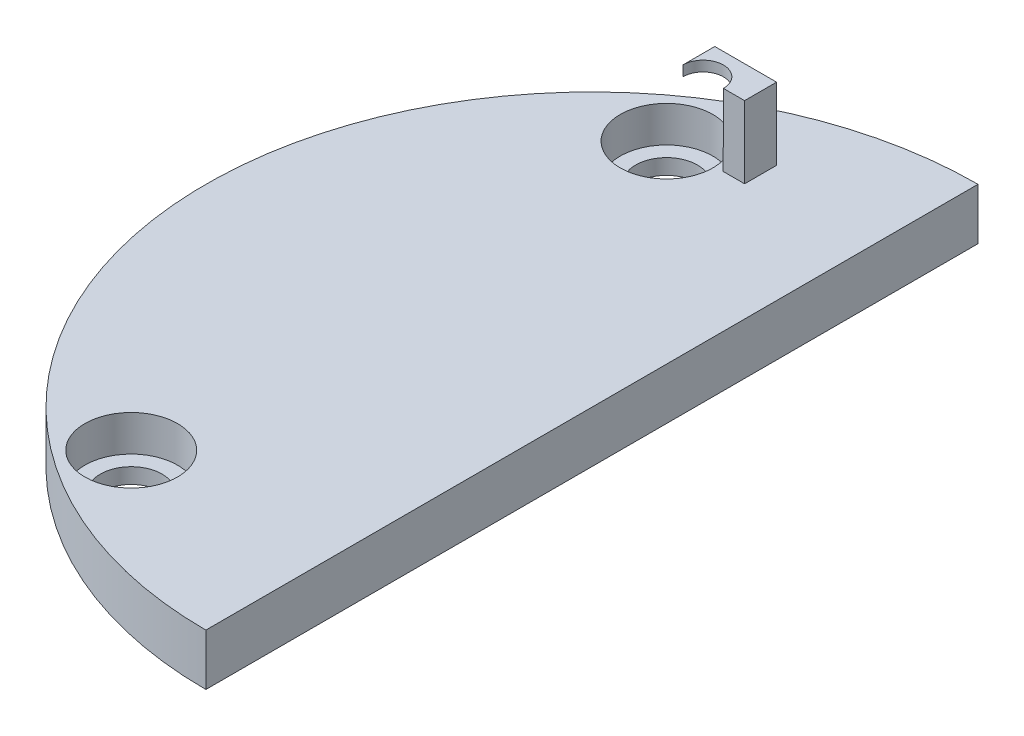
from build123d import *

# Parameters (mm, degrees)
AUFSATZ_LINEAR_AUSTRAGEN1_DEPTH = 5
SKIZZE11_R                      = 4.5
SCHNITT_LINEAR_AUSTRAGEN1_DEPTH = 3.5
SKIZZE12_R                      = 3
SCHNITT_LINEAR_AUSTRAGEN2_DEPTH = 1.5
SKIZZE13_W                      = 2.085762608
SKIZZE13_H                      = 3.10677117
AUFSATZ_LINEAR_AUSTRAGEN2_DEPTH = 6
SKIZZE14_W                      = 6
SKIZZE14_H                      = 3.10677117
AUFSATZ_LINEAR_AUSTRAGEN3_DEPTH = 1
SCHNITT_LINEAR_AUSTRAGEN3_DEPTH = 5


with BuildPart() as part:
    # Skizze1 → Aufsatz-Linear austragen1 (new body)
    with BuildSketch(Plane(origin=(0, 0, 0), x_dir=(1, 0, 0), z_dir=(0, 1, 0))):
        with BuildLine():
            Line((0, 0), (0, -75))
            ThreePointArc((0, -75), (-37.5, -37.5), (0, 0))
        make_face()
    extrude(amount=AUFSATZ_LINEAR_AUSTRAGEN1_DEPTH)

    # Skizze11 → Schnitt-Linear austragen1 (cut)
    with BuildSketch(Plane(origin=(0, 5, 0), x_dir=(1, 0, 0), z_dir=(0, 1, 0))):
        with Locations((-18.75, -11.5)):
            Circle(SKIZZE11_R)
        with Locations((-18.75, -63.5)):
            Circle(SKIZZE11_R)
    extrude(amount=-SCHNITT_LINEAR_AUSTRAGEN1_DEPTH, mode=Mode.SUBTRACT)

    # Skizze12 → Schnitt-Linear austragen2 (cut)
    with BuildSketch(Plane(origin=(0, 1.5, 0), x_dir=(1, 0, 0), z_dir=(0, 1, 0))):
        with Locations((-18.75, -63.5)):
            Circle(SKIZZE12_R)
        with Locations((-18.75, -11.5)):
            Circle(SKIZZE12_R)
    extrude(amount=-SCHNITT_LINEAR_AUSTRAGEN2_DEPTH, mode=Mode.SUBTRACT)

    # Skizze13 → Aufsatz-Linear austragen2 (add)
    with BuildSketch(Plane(origin=(0, 5, 0), x_dir=(1, 0, 0), z_dir=(0, 1, 0))):
        with Locations((-12.416205268, -9.745021236)):
            Rectangle(SKIZZE13_W, SKIZZE13_H)
    extrude(amount=AUFSATZ_LINEAR_AUSTRAGEN2_DEPTH)

    # Skizze14 → Aufsatz-Linear austragen3 (add)
    with BuildSketch(Plane(origin=(0, 11, 0), x_dir=(1, 0, 0), z_dir=(0, 1, 0))):
        with Locations((-14.373323964, -9.745021236)):
            Rectangle(SKIZZE14_W, SKIZZE14_H)
    extrude(amount=AUFSATZ_LINEAR_AUSTRAGEN3_DEPTH)

    # Skizze16 → Schnitt-Linear austragen3 (cut)
    with BuildSketch(Plane(origin=(0, 12, 0), x_dir=(1, 0, 0), z_dir=(0, 1, 0))):
        with BuildLine():
            Line((-17.373323964, -11.298406821), (-13.43004884, -11.298406821))
            ThreePointArc((-13.43004884, -11.298406821), (-15.401686402, -9.326769259), (-17.373323964, -11.298406821))
        make_face()
    extrude(amount=-SCHNITT_LINEAR_AUSTRAGEN3_DEPTH, mode=Mode.SUBTRACT)


solid = part.part
